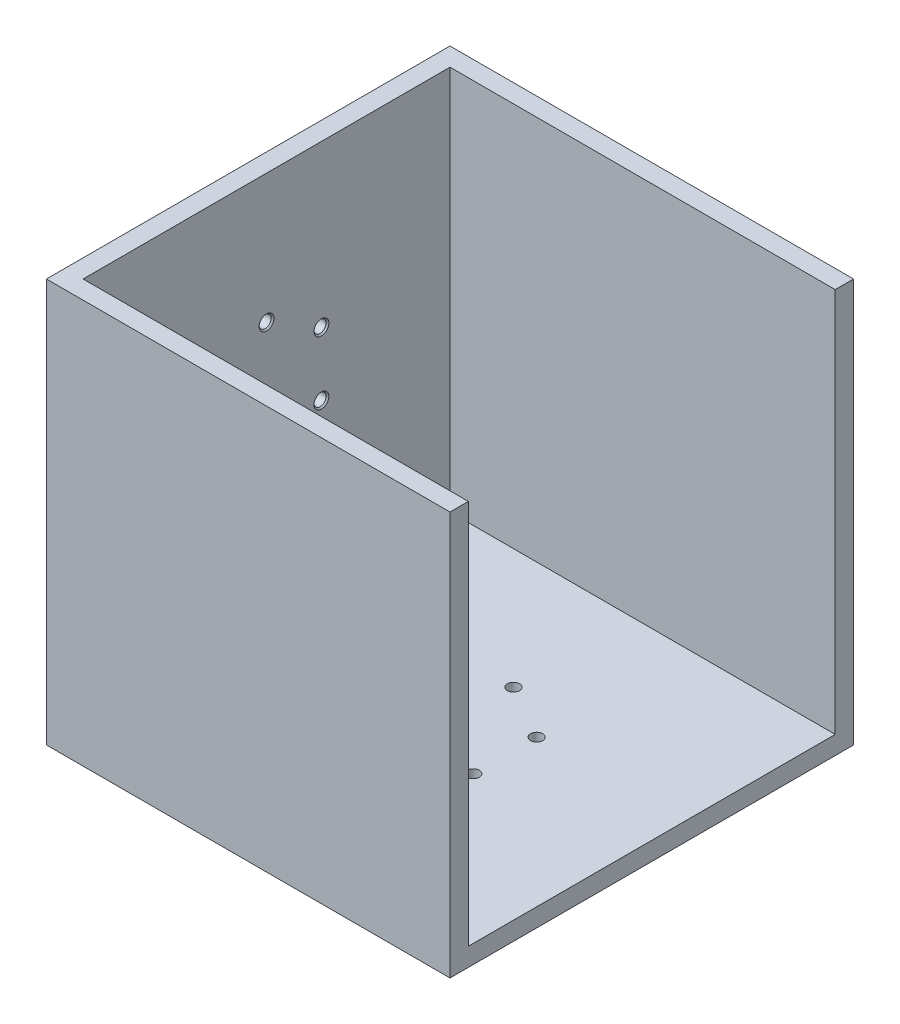
from build123d import *

# Parameters (mm, degrees)
SKETCH_1_W                   = 110
SKETCH_1_H                   = 110
EXTRUDE_1_DEPTH              = 110
SKETCH_2_W                   = 100
SKETCH_2_H                   = 100
CUT_EXTRUDE_1_DEPTH          = 105
SKETCH_3_W                   = 13.484754144
SKETCH_3_H                   = 100
CUT_EXTRUDE_2_DEPTH          = 105
HOLE_WIZARD_M4_6_D           = 3.3
HOLE_WIZARD_M4_6_CSINK_D     = 4.05
HOLE_WIZARD_M4_6_CSINK_ANGLE = 90
HOLE_WIZARD_M4_7_D           = 3.3
HOLE_WIZARD_M4_7_CSINK_D     = 4.05
HOLE_WIZARD_M4_7_CSINK_ANGLE = 90
PATTERN_CIRCULAR_2_COUNT     = 6


# Read off the part's stored shape, not the designer's step: 阵列(圆周)1
with BuildPart() as part:
    # 草图1 → 凸台-拉伸1 (new body)
    with BuildSketch(Plane(origin=(0, 0, 0), x_dir=(1, 0, 0), z_dir=(0, 1, 0))):
        Rectangle(SKETCH_1_W, SKETCH_1_H)
    extrude(amount=EXTRUDE_1_DEPTH)

    # 草图2 → 切除-拉伸1 (cut)
    with BuildSketch(Plane(origin=(0, 110, 0), x_dir=(1, 0, 0), z_dir=(0, 1, 0))):
        Rectangle(SKETCH_2_W, SKETCH_2_H)
    extrude(amount=-CUT_EXTRUDE_1_DEPTH, mode=Mode.SUBTRACT)

    # 草图3 → 切除-拉伸2 (cut)
    with BuildSketch(Plane(origin=(0, 110, 0), x_dir=(1, 0, 0), z_dir=(0, 1, 0))):
        with Locations((56.742377072, 0)):
            Rectangle(SKETCH_3_W, SKETCH_3_H)
    extrude(amount=-CUT_EXTRUDE_2_DEPTH, mode=Mode.SUBTRACT)

    # M4 螺纹孔6 (through all)
    with Locations(Plane.XZ):
        with Locations((0, 17.25)):
            CounterSinkHole(HOLE_WIZARD_M4_6_D / 2, HOLE_WIZARD_M4_6_CSINK_D / 2, counter_sink_angle=HOLE_WIZARD_M4_6_CSINK_ANGLE)

    # 阵列(圆周)1 outline → 阵列(圆周)1 (revolve, cut)
    with BuildSketch(Plane(origin=(-14.954860189, 0, 8.615807444), x_dir=(1, 0, 0), z_dir=(0, 0, 1))):
        Polygon((1.65, 0.375), (1.65, 5), (0, 5), (0, 0), (2.025, 0), align=None)
    revolve(axis=Axis((-14.954860189, 0, 8.615807444), (0, 1, 0)), mode=Mode.SUBTRACT)

    # Pattern Circular 1 2 outline → Pattern Circular 1 2 (revolve, cut)
    with BuildSketch(Plane(origin=(-14.954860189, 0, -8.652577668), x_dir=(1, 0, 0), z_dir=(0, 0, 1))):
        Polygon((1.65, 0.375), (1.65, 5), (0, 5), (0, 0), (2.025, 0), align=None)
    revolve(axis=Axis((-14.954860189, 0, -8.652577668), (0, 1, 0)), mode=Mode.SUBTRACT)

    # Pattern Circular 1 3 outline → Pattern Circular 1 3 (revolve, cut)
    with BuildSketch(Plane.XY.offset(-17.286770224)):
        Polygon((1.65, 0.375), (1.65, 5), (0, 5), (0, 0), (2.025, 0), align=None)
    revolve(axis=Axis((0, 0, -17.286770224), (0, 1, 0)), mode=Mode.SUBTRACT)

    # Pattern Circular 1 4 outline → Pattern Circular 1 4 (revolve, cut)
    with BuildSketch(Plane(origin=(14.954860189, 0, -8.652577668), x_dir=(1, 0, 0), z_dir=(0, 0, 1))):
        Polygon((1.65, 0.375), (1.65, 5), (0, 5), (0, 0), (2.025, 0), align=None)
    revolve(axis=Axis((14.954860189, 0, -8.652577668), (0, 1, 0)), mode=Mode.SUBTRACT)

    # Pattern Circular 1 5 outline → Pattern Circular 1 5 (revolve, cut)
    with BuildSketch(Plane(origin=(14.954860189, 0, 8.615807444), x_dir=(1, 0, 0), z_dir=(0, 0, 1))):
        Polygon((1.65, 0.375), (1.65, 5), (0, 5), (0, 0), (2.025, 0), align=None)
    revolve(axis=Axis((14.954860189, 0, 8.615807444), (0, 1, 0)), mode=Mode.SUBTRACT)

    # M4 螺纹孔7 (through all)
    with Locations(Plane(origin=(-50, 0, 0), x_dir=(0, 0, -1), z_dir=(1, 0, 0))):
        with Locations((0, 74.75)):
            hole_wizard_m4_7 = CounterSinkHole(HOLE_WIZARD_M4_7_D / 2, HOLE_WIZARD_M4_7_CSINK_D / 2, counter_sink_angle=HOLE_WIZARD_M4_7_CSINK_ANGLE)

    # 阵列(圆周)2: M4 螺纹孔7 ×6 about axis
    pattern_circular_2_axis = Axis((0, 57.478809906, 0), (1, 0, 0))
    for i in range(1, PATTERN_CIRCULAR_2_COUNT):
        add(hole_wizard_m4_7.rotate(pattern_circular_2_axis, i * 360 / PATTERN_CIRCULAR_2_COUNT), mode=Mode.SUBTRACT)


solid = part.part
